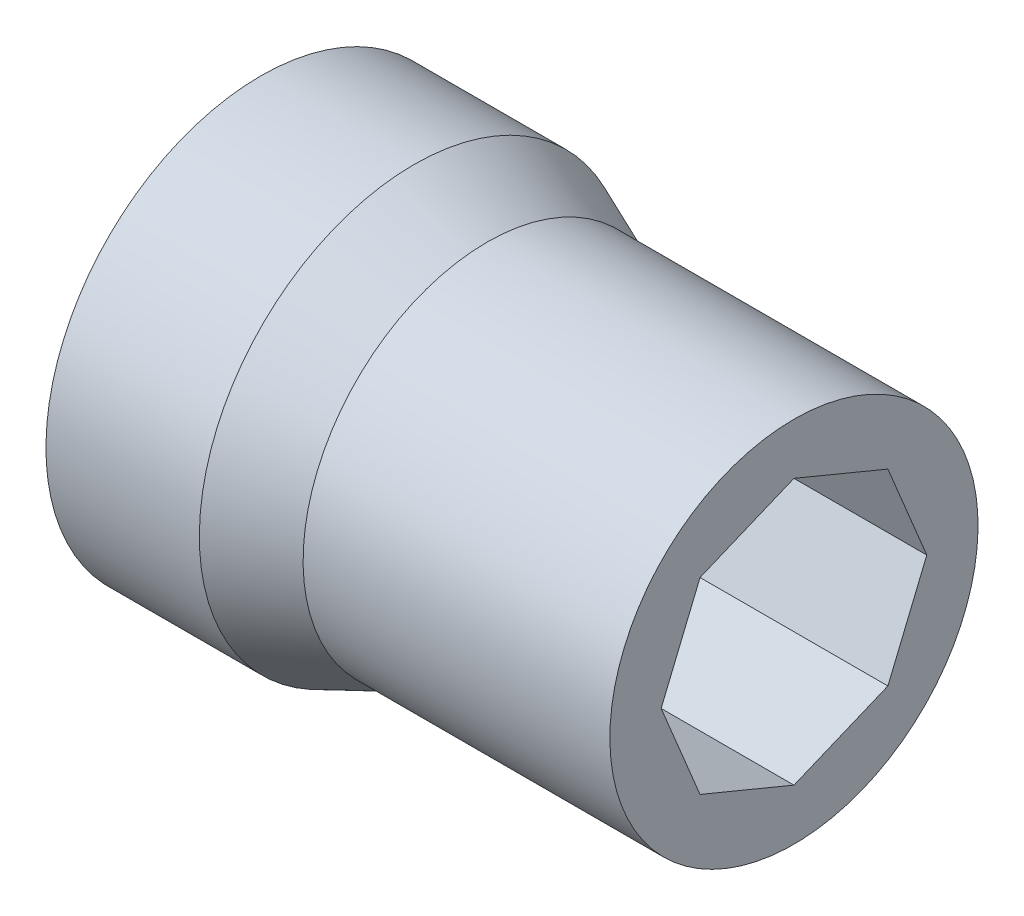
from build123d import *

# Parameters (mm, degrees)
CUT_EXTRUDE2_DEPTH = 4


with BuildPart() as part:
    # Sketch4 → Revolve4 (revolve)
    with BuildSketch(Plane.XY):
        Polygon((-5, 0), (0, 0), (3.690598923, 0), (3.690598923, 3), (0, 3), (-1.309401077, 3), (-2.5, 3.5), (-5, 3.5), align=None)
    revolve(axis=Axis((0, 0, 0), (-1, 0, 0)))

    # Sketch6 → Cut-Extrude2 (cut)
    with BuildSketch(Plane(origin=(3.690598923, 0, 0), x_dir=(0, 0, -1), z_dir=(1, 0, 0))):
        Polygon((-2.164784401, 0), (-1.530733729, -1.530733729), (0, -2.164784401), (1.530733729, -1.530733729), (2.164784401, 0), (1.530733729, 1.530733729), (0, 2.164784401), (-1.530733729, 1.530733729), align=None)
    extrude(amount=-CUT_EXTRUDE2_DEPTH, mode=Mode.SUBTRACT)


solid = part.part
